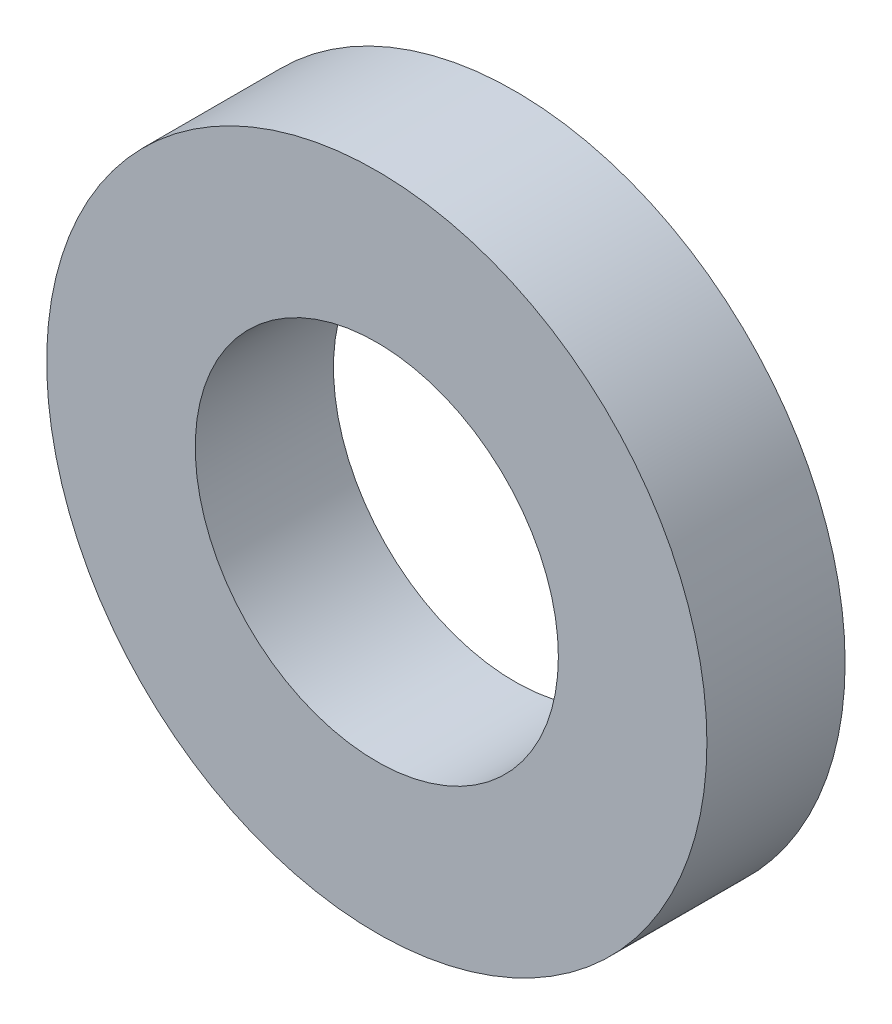
from build123d import *

# Parameters (mm, degrees)
SKETCH1_R           = 9.525
SKETCH1_R_2         = 5.23875
BOSS_EXTRUDE1_DEPTH = 1.993750013


with BuildPart() as part:
    # Sketch1 → Boss-Extrude1 (new, symmetric)
    with BuildSketch(Plane.XY):
        Circle(SKETCH1_R)
        Circle(SKETCH1_R_2, mode=Mode.SUBTRACT)
    extrude(amount=BOSS_EXTRUDE1_DEPTH, both=True)


solid = part.part
